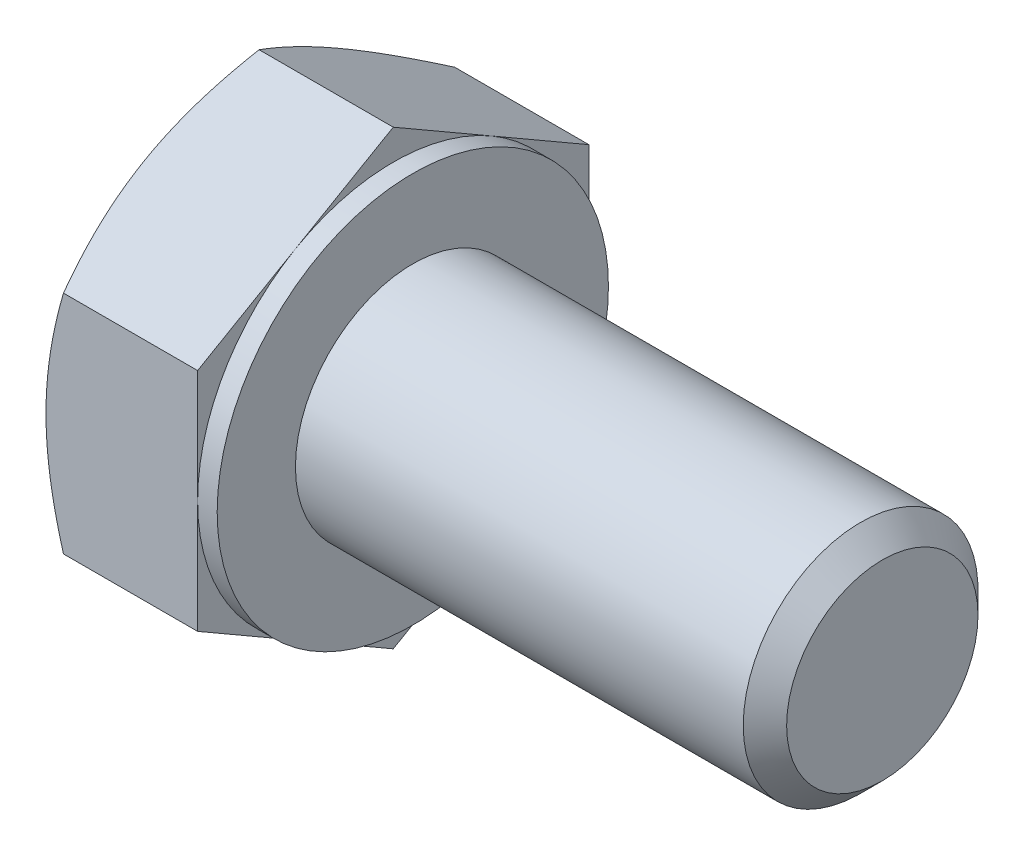
from build123d import *

# Parameters (mm, degrees)
BASEHEAD_DEPTH = 4.375
SKETCH4_W      = 0.5
SKETCH4_H      = 10.773502692


# Read off the part's stored shape, not the designer's step: HeadChamfer
with BuildPart() as part:
    # Sketch1 → BaseHead (new body)
    with BuildSketch(Plane(origin=(0, 0, 0), x_dir=(0, 0, -1), z_dir=(1, 0, 0))):
        Polygon((5, 2.886751346), (5, -2.886751346), (0, -5.773502692), (-5, -2.886751346), (-5, 2.886751346), (0, 5.773502692), align=None)
    extrude(amount=BASEHEAD_DEPTH)

    # HeadChamfer outline → HeadChamfer (revolve, cut)
    with BuildSketch(Plane.YX):
        Polygon((5.773502688, 0.446581985), (4.999998827, -6.77e-07), (5.773502692, -8.45e-07), align=None)
    revolve(axis=Axis((0, 0, 0), (1, 0, 0)), mode=Mode.SUBTRACT)

    # HeadChamfer 2 outline → HeadChamfer 2 (revolve)
    with BuildSketch(Plane.YX):
        Polygon((3, 4.375), (3, 15.8205), (2.4455, 16.375), (0, 16.375), (0, 4.375), align=None)
    revolve(axis=Axis((0, 0, 0), (1, 0, 0)))

    # Sketch4 → BearingFace (revolve, cut)
    with BuildSketch(Plane.XY, mode=Mode.PRIVATE) as bearingface_sk:
        with Locations((4.125, 10.386751346)):
            Rectangle(SKETCH4_W, SKETCH4_H)
    revolve(bearingface_sk.sketch.rotate(Axis((0, 0, 0), (1, 0, 0)), 90), axis=Axis((0, 0, 0), (1, 0, 0)), mode=Mode.SUBTRACT)


solid = part.part
